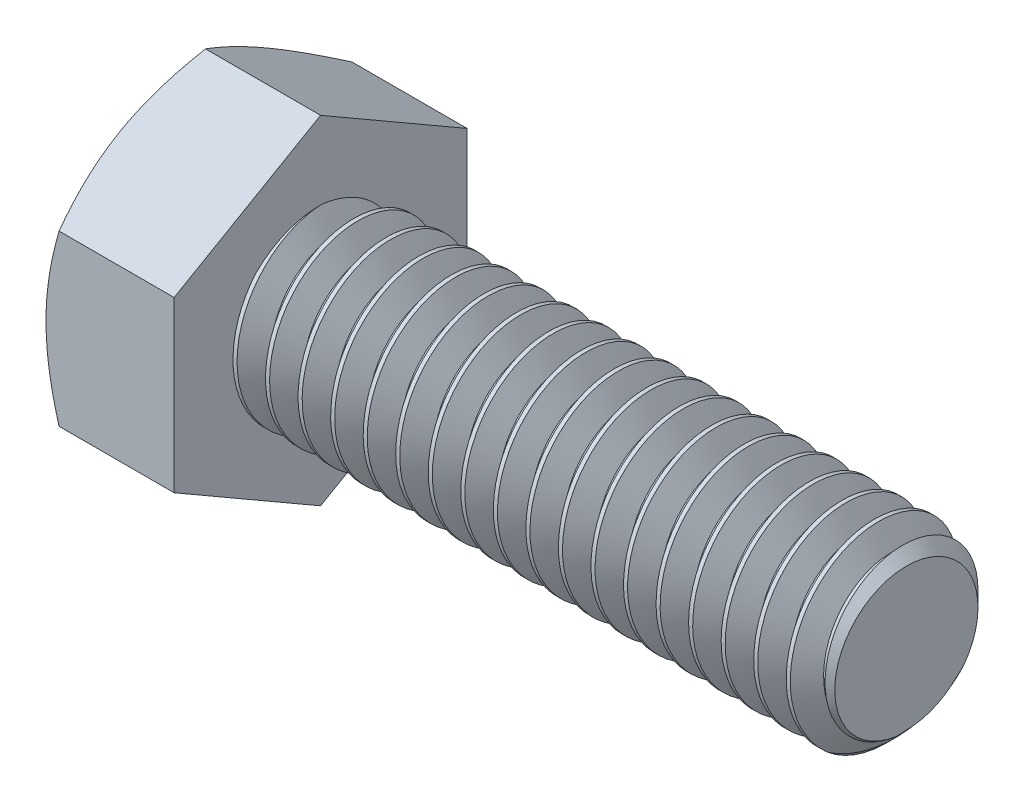
from build123d import *

# Parameters (mm, degrees)
SKETCH5_R           = 3.96875
BOSS_EXTRUDE3_DEPTH = 25.4
CHAMFER1_SIZE       = 0.8636
CUT_SWEEP1_PITCH    = 1.411111111
BOSS_EXTRUDE4_DEPTH = 5.55625
SKETCH8_OUTSIDE_W   = 137.848
SKETCH8_OUTSIDE_H   = 139.812
SKETCH8_OUTSIDE_R   = 6.35
CUT_EXTRUDE3_DEPTH  = 33.440333789
CUT_EXTRUDE3_DRAFT  = -60
CUT_EXTRUDE4_DEPTH  = 0.254
CIRPATTERN1_COUNT   = 3


with BuildPart() as part:
    # Sketch5 → Boss-Extrude3 (new body)
    with BuildSketch(Plane(origin=(15.478125, 0, 0), x_dir=(0, 0, -1), z_dir=(1, 0, 0))):
        Circle(SKETCH5_R)
    extrude(amount=-BOSS_EXTRUDE3_DEPTH)

    # Chamfer1
    chamfer1_edges = [part.edges().sort_by_distance(p)[0] for p in [
        (15.478125, 0, 3.96875),
    ]]
    chamfer(chamfer1_edges, length=CHAMFER1_SIZE)

    # Cut-Sweep1: the profile of Sketch10 profile screwed along a right-hand helix of 19 turns, 8 arcs to a turn; built about Z, then put on its axis
    cut_sweep1_z = Axis((0, 0, 0), (0, 0, 1))
    cut_sweep1_corners = [(3.96905, 0, 0.000173205), (3.052206448, 0, -0.529166667), (3.052206448, 0, -0.705555556), (3.96905, 0, -1.234895427)]
    with BuildLine(mode=Mode.PRIVATE) as cut_sweep1_profile:
        Line(cut_sweep1_corners[0], cut_sweep1_corners[1])
        Line(cut_sweep1_corners[1], cut_sweep1_corners[2])
        Line(cut_sweep1_corners[2], cut_sweep1_corners[3])
        Line(cut_sweep1_corners[3], cut_sweep1_corners[0])
    cut_sweep1_cap = Face(cut_sweep1_profile.wire())
    cut_sweep1_turn_angles = [0, 22.5, 45, 67.5, 90, 112.5, 135, 157.5, 180, 202.5, 225, 247.5, 270, 292.5, 315, 337.5, 360]
    cut_sweep1_turn_weights = [1, 0.9238795325112867, 1, 0.9238795325112867, 1, 0.9238795325112867, 1, 0.9238795325112867, 1, 0.9238795325112867, 1, 0.9238795325112867, 1, 0.9238795325112867, 1, 0.9238795325112867, 1]
    cut_sweep1_turn_rails = [Edge.make_bspline([Vector(p[0], p[1], 0).rotate(cut_sweep1_z, cut_sweep1_turn_angles[k]) / cut_sweep1_turn_weights[k] + Vector(0, 0, p[2] + CUT_SWEEP1_PITCH * cut_sweep1_turn_angles[k] / 360) for k in range(17)], [0, 0, 0, 1, 1, 2, 2, 3, 3, 4, 4, 5, 5, 6, 6, 7, 7, 8, 8, 8], 2, cut_sweep1_turn_weights) for p in cut_sweep1_corners]
    cut_sweep1_turn_sides = [Face.make_surface_from_curves(cut_sweep1_turn_rails[p[0]], cut_sweep1_turn_rails[p[1]]) for p in [(0, 1), (1, 2), (2, 3), (3, 0)]]
    cut_sweep1 = Plane(origin=(15.478125, 0, 0), x_dir=(0, 1, 0), z_dir=(-1, 0, 0)) * Solid(Shell([*[p.moved(Location((0, 0, CUT_SWEEP1_PITCH * i))) for i in range(19) for p in cut_sweep1_turn_sides], cut_sweep1_cap, cut_sweep1_cap.rotate(cut_sweep1_z, 6840).moved(Location((0, 0, CUT_SWEEP1_PITCH * 6840 / 360)))]))
    add(cut_sweep1, mode=Mode.SUBTRACT)

    # Sketch6 → Boss-Extrude4 (add)
    with BuildSketch(Plane.ZY.offset(9.921875)):
        Polygon((6.35, 3.666174209), (0, 7.332348419), (-6.35, 3.666174209), (-6.35, -3.666174209), (0, -7.332348419), (6.35, -3.666174209), align=None)
    extrude(amount=BOSS_EXTRUDE4_DEPTH)


with BuildPart() as cut_extrude3_tool:
    # Sketch8 outside → Cut-Extrude3 (with draft: the straight prism first)
    with BuildSketch(Plane.ZY.offset(15.478125)):
        Rectangle(SKETCH8_OUTSIDE_W, SKETCH8_OUTSIDE_H)
        Circle(SKETCH8_OUTSIDE_R, mode=Mode.SUBTRACT)
    extrude(amount=-CUT_EXTRUDE3_DEPTH)
    # Cut-Extrude3: the draft: its side faces are tilted about the plane it starts from
    cut_extrude3_sides = [cut_extrude3_tool.faces().sort_by_distance(p)[0] for p in [
        (1.242041895, -69.906, 0),
        (1.242041895, 0, 68.924),
        (1.242041895, 69.906, 0),
        (1.242041895, 0, -68.924),
        (1.242041895, 0, -6.35),
    ]]
    draft(cut_extrude3_sides, Plane.ZY.offset(15.478125), CUT_EXTRUDE3_DRAFT)


with BuildPart() as part_1:
    add(part.part)

    # Cut-Extrude3: cut by cut_extrude3_tool
    add(cut_extrude3_tool.part, mode=Mode.SUBTRACT)

    # Sketch12 → Cut-Extrude4 (cut)
    with BuildSketch(Plane.ZY.offset(15.478125)):
        with BuildLine():
            Line((0.1905, 4.8895), (0.1905, 2.7305))
            ThreePointArc((0.1905, 2.7305), (0, 2.54), (-0.1905, 2.7305))
            Line((-0.1905, 2.7305), (-0.1905, 4.8895))
            ThreePointArc((-0.1905, 4.8895), (0, 5.08), (0.1905, 4.8895))
        make_face()
    cut_extrude4 = extrude(amount=-CUT_EXTRUDE4_DEPTH, mode=Mode.SUBTRACT)

    # CirPattern1: Cut-Extrude4 ×3 about axis
    cirpattern1_axis = Axis((0, 0, 0), (1, 0, 0))
    for i in range(1, CIRPATTERN1_COUNT):
        add(cut_extrude4.rotate(cirpattern1_axis, i * 360 / CIRPATTERN1_COUNT), mode=Mode.SUBTRACT)


solid = part_1.part
